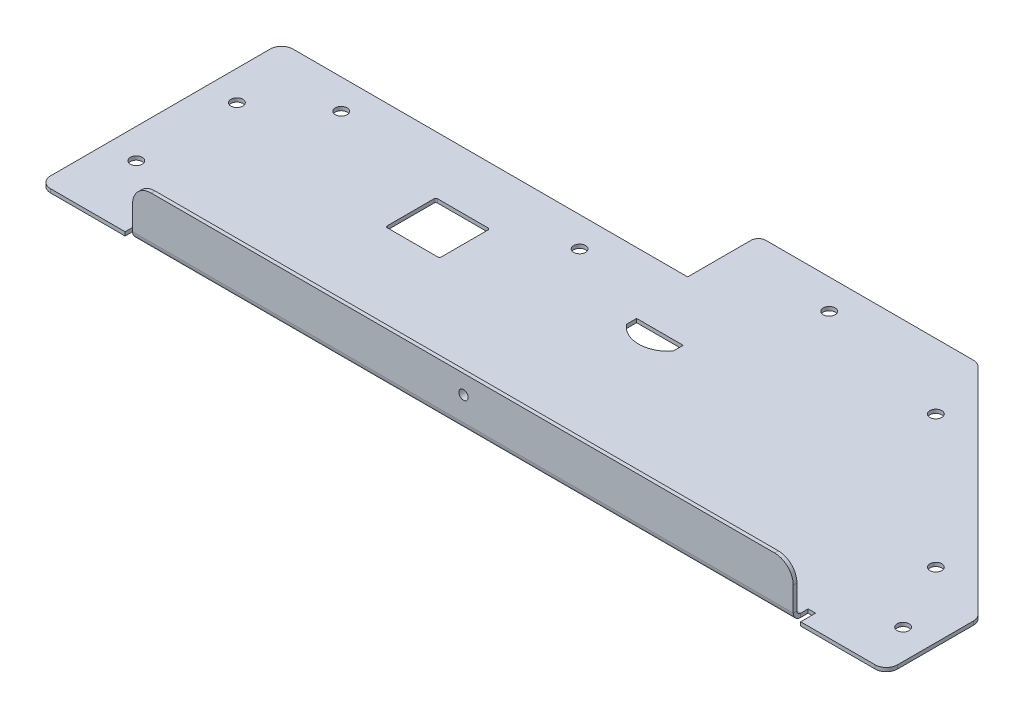
from build123d import *

# Parameters (mm, degrees)
SKETCH_1_R                        = 1.6
SM_BASE_FLANGE_1_DEPTH            = 1
SM_EDGE_FLANGE_1_STRIP_W          = 6
SM_EDGE_FLANGE_1_STRIP_H          = 1
SM_EDGE_FLANGE_1_STRIP_CUT_DEPTH  = 177.34
SM_EDGE_FLANGE_1_RELIEF_W         = 8
SM_EDGE_FLANGE_1_RELIEF_H         = 2
SM_EDGE_FLANGE_1_RELIEF_CUT_DEPTH = 1
SM_EDGE_FLANGE_1_DEPTH            = 177.34
SM_EDGE_FLANGE_1_FLAT_DEPTH       = 1
SKETCH_5_R                        = 3
EXTRUDE_1_DEPTH                   = 2
HOLE_WIZARD_M3_1_D                = 2.5


# Sheet-metal steps are written as plain solids
with BuildPart() as part:
    # Sketch 1 → 基体-法兰1 (new body)
    with BuildSketch(Plane(origin=(0, 0, 0), x_dir=(1, 0, 0), z_dir=(0, 1, 0))):
        with BuildLine():
            Line((-113.67, 32.76), (-113.67, -26.24))
            ThreePointArc((-113.67, -26.24), (-112.791320344, -28.361320344), (-110.67, -29.24))
            Line((-110.67, -29.24), (110.67, -29.24))
            ThreePointArc((110.67, -29.24), (112.791320344, -28.361320344), (113.67, -26.24))
            Line((113.67, -26.24), (113.67, -5.882640687))
            ThreePointArc((113.67, -5.882640687), (113.441638598, -4.73459039), (112.791320344, -3.761320344))
            Line((112.791320344, -3.761320344), (55.148679656, 53.881320344))
            ThreePointArc((55.148679656, 53.881320344), (54.17540961, 54.531638598), (53.027359313, 54.76))
            Line((53.027359313, 54.76), (-2.67, 54.76))
            ThreePointArc((-2.67, 54.76), (-4.084213562, 54.174213562), (-4.67, 52.76))
            Line((-4.67, 52.76), (-4.67, 35.76))
            Line((-4.67, 35.76), (-110.67, 35.76))
            ThreePointArc((-110.67, 35.76), (-112.791320344, 34.881320344), (-113.67, 32.76))
        make_face()
        with Locations(Location((-105.67, -11.24, 0), (0, 0, 270))):
            Circle(SKETCH_1_R, mode=Mode.SUBTRACT)
        with Locations(Location((-105.67, 15.76, 0), (0, 0, 270))):
            Circle(SKETCH_1_R, mode=Mode.SUBTRACT)
        with Locations(Location((-89.67, 27.76, 0), (0, 0, 270))):
            Circle(SKETCH_1_R, mode=Mode.SUBTRACT)
        with Locations(Location((-25.67, 27.76, 0), (0, 0, 270))):
            Circle(SKETCH_1_R, mode=Mode.SUBTRACT)
        with Locations(Location((22.33, 46.76, 0), (0, 0, 270))):
            Circle(SKETCH_1_R, mode=Mode.SUBTRACT)
        with Locations(Location((60.516291501, 37.2, 0), (0, 0, 270))):
            Circle(SKETCH_1_R, mode=Mode.SUBTRACT)
        with Locations(Location((96.116291501, 1.6, 0), (0, 0, 270))):
            Circle(SKETCH_1_R, mode=Mode.SUBTRACT)
        with Locations(Location((105.67, -16.74, 0), (0, 0, 270))):
            Circle(SKETCH_1_R, mode=Mode.SUBTRACT)
        with BuildLine():
            Line((10.63, 19.26), (-1.87, 19.26))
            Line((-1.87, 19.26), (-1.87, 16.56))
            ThreePointArc((-1.87, 16.56), (4.38, 13.553746089), (10.63, 16.56))
            Line((10.63, 16.56), (10.63, 19.26))
        make_face(mode=Mode.SUBTRACT)
        with BuildLine():
            Line((-42.37, 19.86), (-42.37, 7.36))
            ThreePointArc((-42.37, 7.36), (-42.516446609, 7.006446609), (-42.87, 6.86))
            Line((-42.87, 6.86), (-56.37, 6.86))
            ThreePointArc((-56.37, 6.86), (-56.723553391, 7.006446609), (-56.87, 7.36))
            Line((-56.87, 7.36), (-56.87, 19.86))
            ThreePointArc((-56.87, 19.86), (-56.723553391, 20.213553391), (-56.37, 20.36))
            Line((-56.37, 20.36), (-42.87, 20.36))
            ThreePointArc((-42.87, 20.36), (-42.516446609, 20.213553391), (-42.37, 19.86))
        make_face(mode=Mode.SUBTRACT)
    extrude(amount=-SM_BASE_FLANGE_1_DEPTH)

    # 边线-法兰1 strip (across the edge) → 边线-法兰1 strip cut (cut)
    with BuildSketch(Plane(origin=(-88.67, 0, 29.24), x_dir=(0, 0, -1), z_dir=(1, 0, 0))):
        with Locations((-1, -0.5)):
            Rectangle(SM_EDGE_FLANGE_1_STRIP_W, SM_EDGE_FLANGE_1_STRIP_H)
    extrude(amount=SM_EDGE_FLANGE_1_STRIP_CUT_DEPTH, mode=Mode.SUBTRACT)

    # 边线-法兰1 relief (on the sheet) → 边线-法兰1 relief cut (cut)
    with BuildSketch(Plane(origin=(-88.67, 0, 27.24), x_dir=(0, 0, -1), z_dir=(0, 1, 0))):
        with Locations((-2, 1)):
            Rectangle(SM_EDGE_FLANGE_1_RELIEF_W, SM_EDGE_FLANGE_1_RELIEF_H)
        with Locations((-2, -178.34)):
            Rectangle(SM_EDGE_FLANGE_1_RELIEF_W, SM_EDGE_FLANGE_1_RELIEF_H)
    extrude(amount=-SM_EDGE_FLANGE_1_RELIEF_CUT_DEPTH, mode=Mode.SUBTRACT)

    # 边线-法兰1 bend section (across the edge) → 边线-法兰1 (add)
    with BuildSketch(Plane(origin=(-88.67, 0, 29.24), x_dir=(0, 0, -1), z_dir=(1, 0, 0))):
        with BuildLine():
            Line((0, 1), (1, 1))
            ThreePointArc((1, 1), (1.292893219, 0.292893219), (2, 0))
            Line((2, 0), (2, -1))
            ThreePointArc((2, -1), (0.585786438, -0.414213562), (0, 1))
        make_face()
    extrude(amount=SM_EDGE_FLANGE_1_DEPTH)

    # 边线-法兰1 profile (on flange) → 边线-法兰1 flat (add)
    with BuildSketch(Plane.XY.offset(29.24)):
        with BuildLine():
            Line((-88.67, 1), (88.67, 1))
            Line((88.67, 1), (88.67, 7.5))
            ThreePointArc((88.67, 7.5), (87.205533906, 11.035533906), (83.67, 12.5))
            Line((83.67, 12.5), (-83.67, 12.5))
            ThreePointArc((-83.67, 12.5), (-87.205533906, 11.035533906), (-88.67, 7.5))
            Line((-88.67, 7.5), (-88.67, 1))
        make_face()
    extrude(amount=-SM_EDGE_FLANGE_1_FLAT_DEPTH)

    # 草图5 → 凸台-拉伸1 (add)
    with BuildSketch(Plane(origin=(0, 0, 28.24), x_dir=(-1, 0, 0), z_dir=(0, 0, -1))):
        with Locations((-0.17, 7.5)):
            Circle(SKETCH_5_R)
    extrude(amount=EXTRUDE_1_DEPTH)

    # M3 螺纹孔1 (through all)
    with Locations(Plane(origin=(0, 0, 26.24), x_dir=(-1, 0, 0), z_dir=(0, 0, -1))):
        with Locations((-0.17, 7.5)):
            Hole(HOLE_WIZARD_M3_1_D / 2)


solid = part.part
